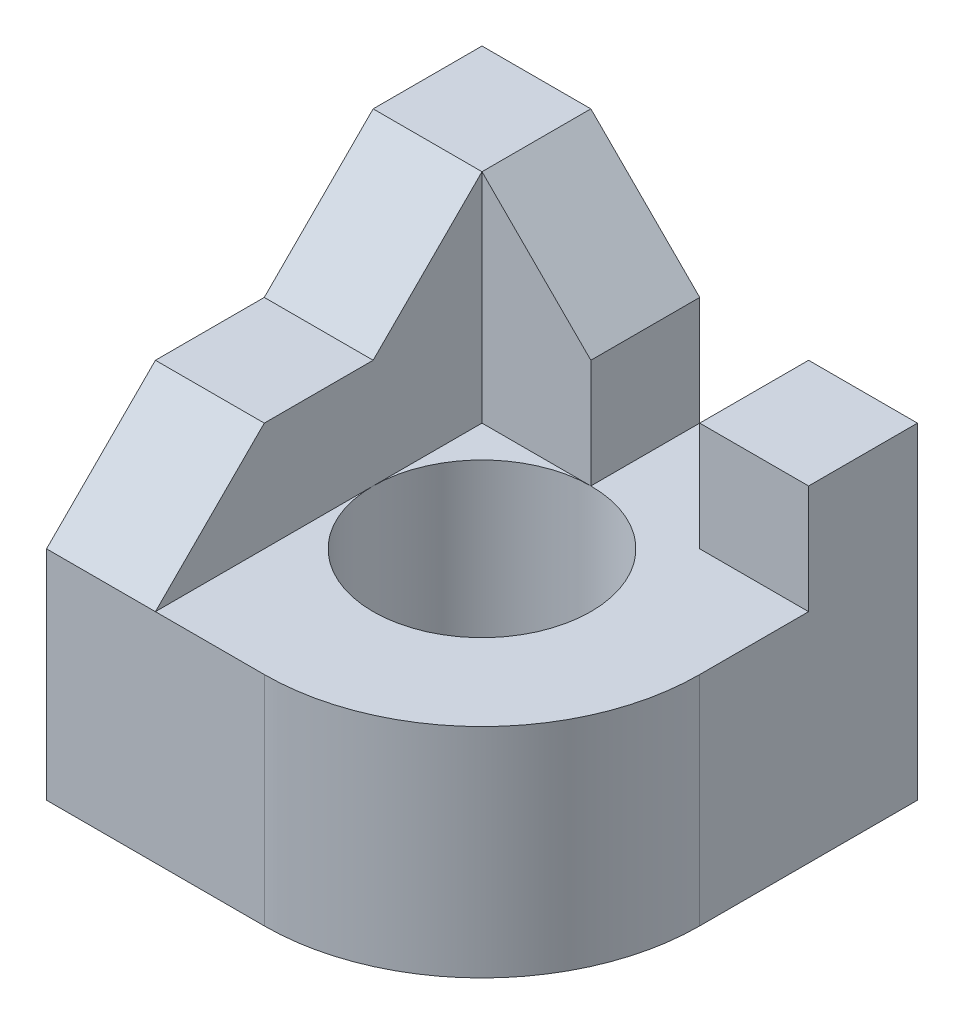
from build123d import *

# Parameters (mm, degrees)
EXTRUDE_1_DEPTH   = 2
EXTRUDE_1_2_DEPTH = 2
SKETCH_1_3_W      = 1
SKETCH_1_3_H      = 1
EXTRUDE_2_DEPTH   = 3
SKETCH_1_4_W      = 1
SKETCH_1_4_H      = 1
EXTRUDE_3_DEPTH   = 4
CHAMFER_1_SIZE    = 1


with BuildPart() as part:
    # 草圖1 → 填料-伸長1 (new body)
    with BuildSketch(Plane(origin=(0, 0, 0), x_dir=(1, 0, 0), z_dir=(0, 1, 0))):
        with BuildLine():
            Line((0, 2), (0, 1))
            ThreePointArc((0, 1), (0.707106781, 0.707106781), (1, 0))
            ThreePointArc((1, 0), (0, -1), (-1, 0))
            Line((-1, 0), (-1, -1))
            Line((-1, -1), (-1, -2))
            Line((-1, -2), (0, -2))
            ThreePointArc((0, -2), (1.414213562, -1.414213562), (2, 0))
            Line((2, 0), (2, 1))
            Line((2, 1), (1, 1))
            Line((1, 1), (1, 2))
            Line((1, 2), (0, 2))
        make_face()
    extrude(amount=EXTRUDE_1_DEPTH)

    # 草圖1<3> → 填料-伸長2 (add)
    with BuildSketch(Plane(origin=(0, 0, 0), x_dir=(1, 0, 0), z_dir=(0, 1, 0))):
        with Locations((1.5, 1.5)):
            Rectangle(SKETCH_1_3_W, SKETCH_1_3_H)
        with Locations((-1.5, -1.5)):
            Rectangle(SKETCH_1_3_W, SKETCH_1_3_H)
        with Locations((-1.5, -0.5)):
            Rectangle(SKETCH_1_3_W, SKETCH_1_3_H)
    extrude(amount=EXTRUDE_2_DEPTH)



with BuildPart() as body_2:
    # 草圖1 → Extrude 1 2 (new body)
    with BuildSketch(Plane(origin=(0, 0, 0), x_dir=(1, 0, 0), z_dir=(0, 1, 0))):
        with BuildLine():
            Line((0, 1), (-1, 1))
            Line((-1, 1), (-1, 0))
            ThreePointArc((-1, 0), (-0.707106781, 0.707106781), (0, 1))
        make_face()
    extrude(amount=EXTRUDE_1_2_DEPTH)


with BuildPart() as part_1:
    add(part.part)

    add(body_2.part)  # 填料-伸長3 merges body 2
    # 草圖1<4> → 填料-伸長3 (add)
    with BuildSketch(Plane(origin=(0, 0, 0), x_dir=(1, 0, 0), z_dir=(0, 1, 0))):
        with Locations((-0.5, 1.5)):
            Rectangle(SKETCH_1_4_W, SKETCH_1_4_H)
        with Locations((-1.5, 1.5)):
            Rectangle(SKETCH_1_4_W, SKETCH_1_4_H)
        with Locations((-1.5, 0.5)):
            Rectangle(SKETCH_1_4_W, SKETCH_1_4_H)
    extrude(amount=EXTRUDE_3_DEPTH)

    # 導角1
    chamfer_1_edges = [part_1.edges().sort_by_distance(p)[0] for p in [
        (0, 4, -1.5),
        (-1.5, 4, 0),
        (-1.5, 3, 2),
    ]]
    chamfer(chamfer_1_edges, length=CHAMFER_1_SIZE - 0.0001)  # a hair under: the kernel refuses the full size


solid = part_1.part
